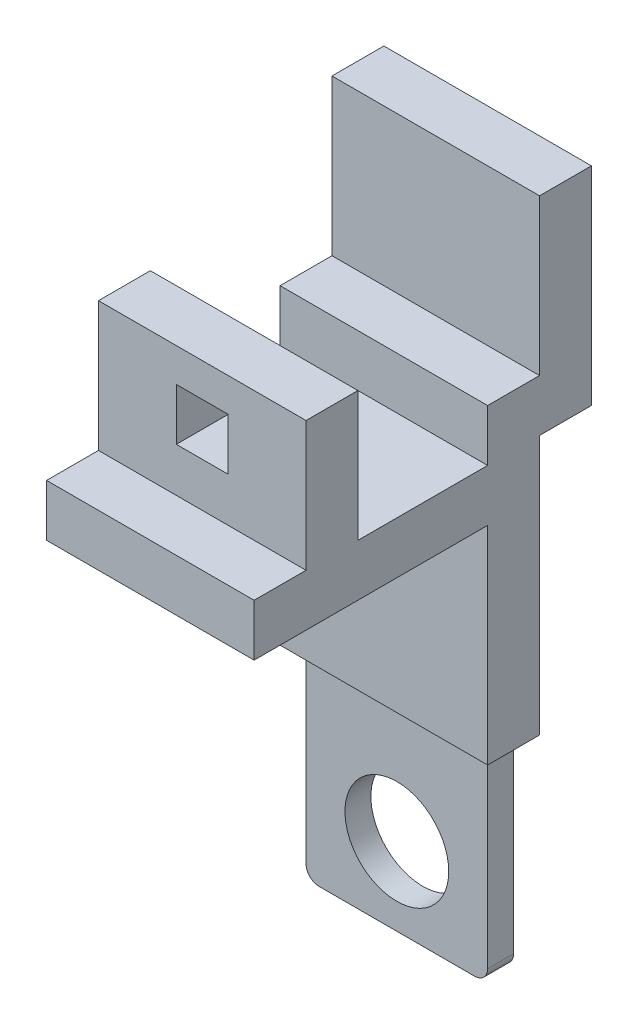
from build123d import *

# Parameters (mm, degrees)
SZKIC1_W                    = 4
SZKIC1_H                    = 1
DODANIE_WYCI_GNI_CIE1_DEPTH = 5
SZKIC2_W                    = 4
SZKIC2_H                    = 1
DODANIE_WYCI_GNI_CIE2_DEPTH = 4.5
SZKIC3_W                    = 4
SZKIC3_H                    = 1
DODANIE_WYCI_GNI_CIE3_DEPTH = 1
SZKIC4_W                    = 4
SZKIC4_H                    = 1
DODANIE_WYCI_GNI_CIE4_DEPTH = 1
SZKIC5_W                    = 4
SZKIC5_H                    = 1
DODANIE_WYCI_GNI_CIE5_DEPTH = 3
SZKIC6_W                    = 4
SZKIC6_H                    = 1
DODANIE_WYCI_GNI_CIE6_DEPTH = 2.5
SZKIC8_W                    = 3.5
SZKIC8_H                    = 0.5
DODANIE_WYCI_GNI_CIE7_DEPTH = 3.9
SZKIC9_R                    = 1
WYTNIJ_WYCI_GNI_CIE2_DEPTH  = 3.9
ZAOKR_GLENIE1_R             = 0.25
SZKIC10_W                   = 1
SZKIC10_H                   = 1
WYTNIJ_WYCI_GNI_CIE3_DEPTH  = 1


with BuildPart() as part:
    # Szkic1 → Dodanie-wyciągnięcie1 (new body)
    with BuildSketch(Plane(origin=(0, 0, 0), x_dir=(1, 0, 0), z_dir=(0, 1, 0))):
        Rectangle(SZKIC1_W, SZKIC1_H)
    extrude(amount=DODANIE_WYCI_GNI_CIE1_DEPTH)

    # Szkic2 → Dodanie-wyciągnięcie2 (add)
    with BuildSketch(Plane.XY.offset(0.5)):
        with Locations((0, 4.5)):
            Rectangle(SZKIC2_W, SZKIC2_H)
    extrude(amount=DODANIE_WYCI_GNI_CIE2_DEPTH)

    # Szkic3 → Dodanie-wyciągnięcie3 (add)
    with BuildSketch(Plane(origin=(0, 5, 0), x_dir=(1, 0, 0), z_dir=(0, 1, 0))):
        Rectangle(SZKIC3_W, SZKIC3_H)
    extrude(amount=DODANIE_WYCI_GNI_CIE3_DEPTH)

    # Szkic4 → Dodanie-wyciągnięcie4 (add)
    with BuildSketch(Plane(origin=(0, 0, -0.5), x_dir=(-1, 0, 0), z_dir=(0, 0, -1))):
        with Locations((0, 5.5)):
            Rectangle(SZKIC4_W, SZKIC4_H)
    extrude(amount=DODANIE_WYCI_GNI_CIE4_DEPTH)

    # Szkic5 → Dodanie-wyciągnięcie5 (add)
    with BuildSketch(Plane(origin=(0, 6, 0), x_dir=(1, 0, 0), z_dir=(0, 1, 0))):
        with Locations((0, 1)):
            Rectangle(SZKIC5_W, SZKIC5_H)
    extrude(amount=DODANIE_WYCI_GNI_CIE5_DEPTH)

    # Szkic6 → Dodanie-wyciągnięcie6 (add)
    with BuildSketch(Plane(origin=(0, 5, 0), x_dir=(1, 0, 0), z_dir=(0, 1, 0))):
        with Locations((0, -3.5)):
            Rectangle(SZKIC6_W, SZKIC6_H)
    extrude(amount=DODANIE_WYCI_GNI_CIE6_DEPTH)

    # Szkic8 → Dodanie-wyciągnięcie7 (add)
    with BuildSketch(Plane.XZ):
        Rectangle(SZKIC8_W, SZKIC8_H)
    extrude(amount=DODANIE_WYCI_GNI_CIE7_DEPTH)

    # Szkic9 → Wytnij-wyciągnięcie2 (cut)
    with BuildSketch(Plane.XY.offset(0.25)):
        with Locations((0, -2.4)):
            Circle(SZKIC9_R)
    extrude(amount=-WYTNIJ_WYCI_GNI_CIE2_DEPTH, mode=Mode.SUBTRACT)

    # Zaokrąglenie1
    zaokr_glenie1_edges = [part.edges().sort_by_distance(p)[0] for p in [
        (-1.75, 0, 0),
        (0, 0, -0.25),
        (1.75, 0, 0),
        (0, 0, 0.25),
        (-1.75, -3.9, 0),
        (1.75, -3.9, 0),
    ]]
    fillet(zaokr_glenie1_edges, radius=ZAOKR_GLENIE1_R - 0.0001)  # a hair under: the kernel refuses the full size

    # Szkic10 → Wytnij-wyciągnięcie3 (cut)
    with BuildSketch(Plane.XY.offset(4)):
        with Locations((0, 6.352223481)):
            Rectangle(SZKIC10_W, SZKIC10_H)
    extrude(amount=-WYTNIJ_WYCI_GNI_CIE3_DEPTH, mode=Mode.SUBTRACT)


solid = part.part
